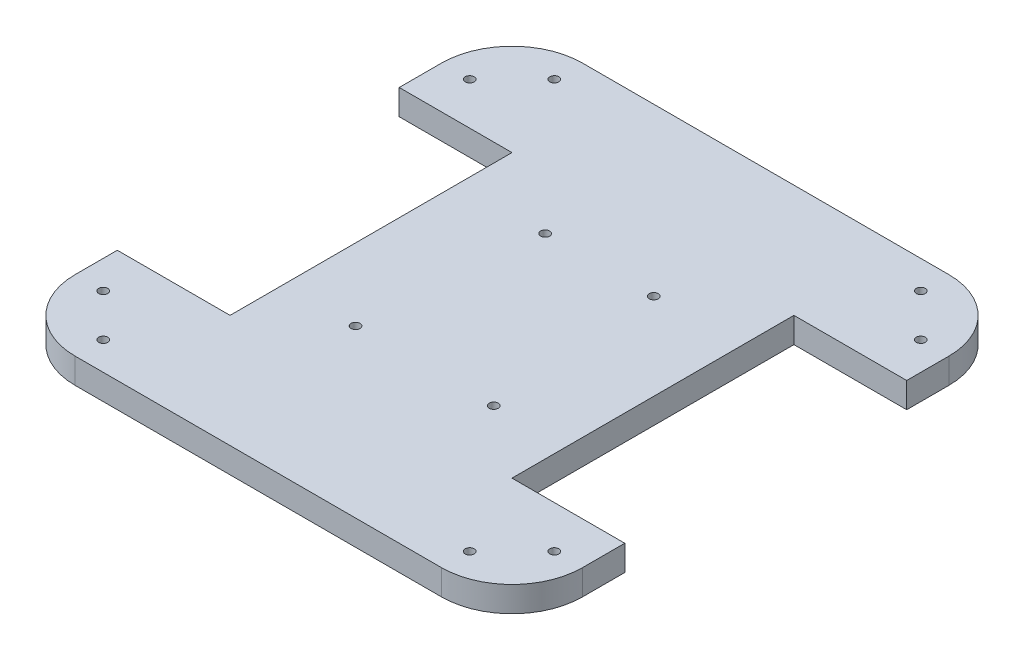
from build123d import *

# Parameters (mm, degrees)
PLATE_DEPTH         = 9
SKETCH3_R           = 1.6
HEX_HOLES_DEPTH     = 128.597021909
SKETCH4_R           = 1.6
ARDUINO_HOLES_DEPTH = 128.597021909
SKETCH5_W           = 40
SKETCH5_H           = 100
CUT_EXTRUDE1_DEPTH  = 128.597021909


with BuildPart() as part:
    # Sketch1 → Plate (new body)
    with BuildSketch(Plane(origin=(0, 0, 0), x_dir=(1, 0, 0), z_dir=(0, 1, 0))):
        with BuildLine():
            Line((-65, -90), (65, -90))
            ThreePointArc((65, -90), (82.67766953, -82.67766953), (90, -65))
            Line((90, -65), (90, 65))
            ThreePointArc((90, 65), (82.67766953, 82.67766953), (65, 90))
            Line((65, 90), (-65, 90))
            ThreePointArc((-65, 90), (-82.67766953, 82.67766953), (-90, 65))
            Line((-90, 65), (-90, -65))
            ThreePointArc((-90, -65), (-82.67766953, -82.67766953), (-65, -90))
        make_face()
    extrude(amount=PLATE_DEPTH)

    # Sketch3 → Hex Holes (cut, through all)
    with BuildSketch(Plane(origin=(0, 9, 0), x_dir=(1, 0, 0), z_dir=(0, 1, 0))):
        with Locations((-65, 80)):
            Circle(SKETCH3_R)
        with Locations((-80, 65)):
            Circle(SKETCH3_R)
        with Locations((80, 65)):
            Circle(SKETCH3_R)
        with Locations((80, -65)):
            Circle(SKETCH3_R)
        with Locations((65, 80)):
            Circle(SKETCH3_R)
        with Locations((65, -80)):
            Circle(SKETCH3_R)
        with Locations((-65, -80)):
            Circle(SKETCH3_R)
        with Locations((-80, -65)):
            Circle(SKETCH3_R)
    extrude(amount=-HEX_HOLES_DEPTH, mode=Mode.SUBTRACT)

    # Sketch4 → Arduino Holes (cut, through all)
    with BuildSketch(Plane(origin=(0, 9, 0), x_dir=(1, 0, 0), z_dir=(0, 1, 0))):
        with Locations((-24.5, -31)):
            Circle(SKETCH4_R)
        with Locations((24.5, -31)):
            Circle(SKETCH4_R)
        with Locations((-19.25, 31)):
            Circle(SKETCH4_R)
        with Locations((19.25, 31)):
            Circle(SKETCH4_R)
    extrude(amount=-ARDUINO_HOLES_DEPTH, mode=Mode.SUBTRACT)

    # Sketch5 → Cut-Extrude1 (cut, through all)
    with BuildSketch(Plane(origin=(0, 9, 0), x_dir=(1, 0, 0), z_dir=(0, 1, 0))):
        with Locations((-70, 0)):
            Rectangle(SKETCH5_W, SKETCH5_H)
        with Locations((70, 0)):
            Rectangle(SKETCH5_W, SKETCH5_H)
    extrude(amount=-CUT_EXTRUDE1_DEPTH, mode=Mode.SUBTRACT)


solid = part.part
